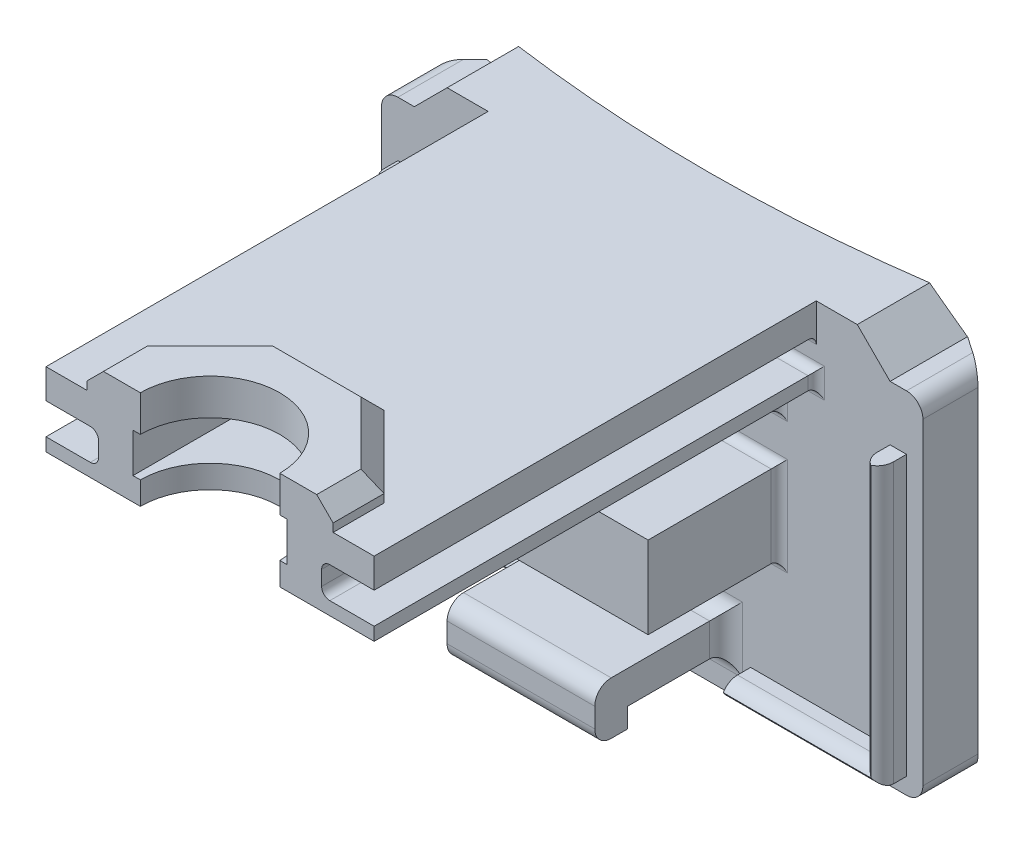
from build123d import *
from build123d.topology import SkipClean

# Parameters (mm, degrees)
BOSS_EXTRUDE1_DEPTH            = 3
SKETCH6_W                      = 20
SKETCH6_H                      = 31.95
BOSS_EXTRUDE5_DEPTH            = 5
CUT_EXTRUDE1_REACH             = 47.155
BOSS_EXTRUDE6_START            = 1.5
BOSS_EXTRUDE6_DEPTH            = 1.5
CHAMFER1_SIZE                  = 1
SKETCH10_W                     = 15.5
SKETCH10_H                     = 22.5
BOSS_EXTRUDE7_DEPTH            = 1.75
BOSS_EXTRUDE8_DEPTH            = 8
BOSS_EXTRUDE9_DEPTH            = 23.35
CHAMFER3_SIZE                  = 1.7121869
CHAMFER3_SIZE_2                = 2
FILLET4_R                      = 1
CHAMFER4_SIZE                  = 2
CUT_EXTRUDE2_DEPTH             = 42.166529183
CUT_EXTRUDE3_DEPTH             = 3.2
CUT_EXTRUDE4_DEPTH             = 3.2
SKETCH16_W                     = 9.2
SKETCH16_H                     = 4.6
CUT_EXTRUDE5_DEPTH             = 2.2
BOSS_EXTRUDE10_DEPTH           = 1.8
BOSS_EXTRUDE11_DEPTH           = 8
SKETCH19_W                     = 9
SKETCH19_H                     = 2
BOSS_EXTRUDE12_DEPTH           = 1.2
FILLET7_R                      = 1
FILLET8_R                      = 1
CUT_EXTRUDE6_DEPTH             = 0.5
CUT_EXTRUDE8_REACH             = 45.001
CUT_EXTRUDE8_DIRECTION_2_REACH = 45.001
BOSS_EXTRUDE13_DEPTH           = 7.6
BOSS_EXTRUDE14_DEPTH           = 1.5
CUT_EXTRUDE9_REACH             = 44.27
CHAMFER6_SIZE                  = 1
CUT_EXTRUDE14_START            = -2.25
CUT_EXTRUDE14_DEPTH            = 2.25
SKETCH30_W                     = 9.2
SKETCH30_H                     = 4.6
CUT_EXTRUDE15_DEPTH            = 3.7
SKETCH31_W                     = 9.2
SKETCH31_H                     = 4.6
BOSS_EXTRUDE16_DEPTH           = 1.5
SKETCH32_R                     = 4
CUT_EXTRUDE16_DEPTH            = 1.5
FILLET9_R                      = 0.5
FILLET10_R                     = 0.5
CUT_EXTRUDE18_DEPTH            = 35.725461753
CUT_EXTRUDE18_DEPTH_BACK       = 2.3
SKETCH34_W                     = 9.4
SKETCH34_H                     = 2.4
FILLET11_R                     = 1
SKETCH35_R                     = 4.25
CUT_EXTRUDE19_DEPTH            = 7


# Some blends are built 0.0001 mm under size
with BuildPart() as part:
    # Sketch1 → Boss-Extrude1 (new body)
    with BuildSketch(Plane.XY):
        Polygon((14.5, 12.675), (-14.5, 12.675), (-14.5, 10.675), (-16.5, 10.675), (-16.5, -10.675), (16.5, -10.675), (16.5, 10.675), (14.5, 10.675), align=None)
    extrude(amount=BOSS_EXTRUDE1_DEPTH)

    # Sketch6 → Boss-Extrude5 (add)
    with BuildSketch(Plane(origin=(0, 12.675, 0), x_dir=(1, 0, 0), z_dir=(0, 1, 0))):
        with Locations((0, -18.975)):
            Rectangle(SKETCH6_W, SKETCH6_H)
    extrude(amount=-BOSS_EXTRUDE5_DEPTH)

    # Sketch7 → Cut-Extrude1 (cut, up to next)
    with BuildSketch(Plane(origin=(0, 12.675, 0), x_dir=(1, 0, 0), z_dir=(0, 1, 0)), mode=Mode.PRIVATE) as cut_extrude1_sk1:
        with BuildLine():
            Line((-4, -34.95), (4, -34.95))
            ThreePointArc((4, -34.95), (0, -30.95), (-4, -34.95))
        make_face()
    cut_extrude1_tool1 = extrude(cut_extrude1_sk1.sketch, amount=-CUT_EXTRUDE1_REACH, mode=Mode.PRIVATE) & part.part
    add(cut_extrude1_tool1.solids().sort_by_distance((0, 12.675, 33.252347))[0], mode=Mode.SUBTRACT)

    # Sketch8 → Boss-Extrude6 (add)
    with BuildSketch(Plane(origin=(0, 12.675, 0), x_dir=(1, 0, 0), z_dir=(0, 1, 0)).offset(BOSS_EXTRUDE6_START)):
        with BuildLine():
            Line((-7.5, -34.95), (-4, -34.95))
            ThreePointArc((-4, -34.95), (0, -30.95), (4, -34.95))
            Line((4, -34.95), (7.5, -34.95))
            Line((7.5, -34.95), (7.5, -31.843398282))
            Line((7.5, -31.843398282), (3.106601718, -27.45))
            Line((3.106601718, -27.45), (-3.106601718, -27.45))
            Line((-3.106601718, -27.45), (-7.5, -31.843398282))
            Line((-7.5, -31.843398282), (-7.5, -34.95))
        make_face()
    extrude(amount=-BOSS_EXTRUDE6_DEPTH)

    # Chamfer1
    chamfer1_edges = [part.edges().sort_by_distance(p)[0] for p in [
        (-7.5, 14.175, 33.396699141),
        (7.5, 14.175, 33.396699141),
        (5.303300859, 14.175, 29.646699141),
        (0, 14.175, 27.45),
        (-5.303300859, 14.175, 29.646699141),
    ]]
    chamfer(chamfer1_edges, length=CHAMFER1_SIZE)

    # Sketch10 → Boss-Extrude7 (add)
    with BuildSketch(Plane.XZ.offset(-7.675)):
        with Locations((0, 14.25)):
            Rectangle(SKETCH10_W, SKETCH10_H)
    extrude(amount=BOSS_EXTRUDE7_DEPTH)

    # Sketch11 → Boss-Extrude8 (add)
    with BuildSketch(Plane.XY.offset(3)):
        Polygon((-7.75, 1.425), (-7.75, -2.075), (7.75, -2.075), (7.75, 1.425), (7.75, 2.925), (-7.75, 2.925), align=None)
    extrude(amount=BOSS_EXTRUDE8_DEPTH)

    # Sketch12 → Boss-Extrude9 (add, through all)
    with BuildSketch(Plane(origin=(0, 12.675, 0), x_dir=(1, 0, 0), z_dir=(0, 1, 0))):
        with BuildLine():
            Line((-16.5, 0), (-16.5, 2))
            ThreePointArc((-16.5, 2), (0.003271262, 0.509953036), (16.5, 2.070767971))
            Line((16.5, 2.070767971), (16.5, 0))
            Line((16.5, 0), (-16.5, 0))
        make_face()
    extrude(amount=-BOSS_EXTRUDE9_DEPTH)

    # Chamfer3
    # the kernel refuses this chamfer: 2, 1.717229303, 1.7121869 mm, written as the material it takes off along each edge
    with BuildSketch(Plane(origin=(16.5, 17.877033417, -2.070767971), x_dir=(0, 0, 1), z_dir=(0, -1, 0))) as chamfer3_piece_1:
        with BuildLine():
            Line((CHAMFER3_SIZE, 0), (0.352759752, 1.991865139))
            ThreePointArc((0.352759752, 1.991865139), (0.186961159, 1.023114885), (0, 0))
            Line((0, 0), (CHAMFER3_SIZE, 0))
        make_face()
    extrude(amount=33.754066833, mode=Mode.SUBTRACT)
    with BuildSketch(Plane(origin=(-16.5, 17.818365976, -2), x_dir=(0.9851367782716596, 0, 0.17177173253051592), z_dir=(0, -1, 0))) as chamfer3_piece_2:
        with BuildLine():
            Line((1.72874517, 0), (CHAMFER3_SIZE_2 * 0.171771732531, CHAMFER3_SIZE_2 * 0.985136778272))
            Line((CHAMFER3_SIZE_2 * 0.171771732531, CHAMFER3_SIZE_2 * 0.985136778272), (0, 0))
            ThreePointArc((0, 0), (0.887387451, 0.004147931), (1.72874517, 0))
        make_face()
    extrude(amount=33.636731952, mode=Mode.SUBTRACT)

    # Fillet4
    fillet4_edges = [part.edges().sort_by_distance(p)[0] for p in [
        (16.5, 10.675, 1.5),
        (16.5, -10.675, 1.320709464),
        (-16.5, -10.675, 1.5),
        (-16.5, 10.675, 1.5),
    ]]
    fillet(fillet4_edges, radius=FILLET4_R)

    # Chamfer4
    chamfer4_edges = [part.edges().sort_by_distance(p)[0] for p in [
        (-14.5, 12.675, 1.5),
        (14.5, 12.675, 1.5),
    ]]
    chamfer(chamfer4_edges, length=CHAMFER4_SIZE - 0.0001)  # a hair under: the kernel refuses the full size

    # Sketch13 → Cut-Extrude2 (cut, through all)
    with SkipClean():  # the faces are left unmerged after this step: merging them gives an invalid solid
        with BuildSketch(Plane.XY):
            with BuildLine():
                Line((12.5, 12.675), (16.5, 12.675))
                Line((16.5, 12.675), (16.5, 9.675))
                ThreePointArc((16.5, 9.675), (16.207106781, 10.382106781), (15.5, 10.675))
                Line((15.5, 10.675), (14.5, 10.675))
                Line((14.5, 10.675), (12.5, 12.675))
            make_face()
            with BuildLine():
                Line((-12.5, 12.675), (-16.5, 12.675))
                Line((-16.5, 12.675), (-16.5, 9.675))
                ThreePointArc((-16.5, 9.675), (-16.207106781, 10.382106781), (-15.5, 10.675))
                Line((-15.5, 10.675), (-14.5, 10.675))
                Line((-14.5, 10.675), (-12.5, 12.675))
            make_face()
        extrude(amount=-CUT_EXTRUDE2_DEPTH, mode=Mode.SUBTRACT)

    # Sketch14 → Cut-Extrude3 (cut)
    with SkipClean():  # the faces are left unmerged after this step: merging them gives an invalid solid
        with BuildSketch(Plane(origin=(10, 0, 0), x_dir=(0, 0, -1), z_dir=(1, 0, 0))):
            Polygon((-34.95, 10.875), (-34.95, 8.975), (-29.75, 8.975), (-3, 8.975), (-3, 10.875), (-29.75, 10.875), align=None)
        extrude(amount=-CUT_EXTRUDE3_DEPTH, mode=Mode.SUBTRACT)

    # Sketch15 → Cut-Extrude4 (cut)
    with SkipClean():  # the faces are left unmerged after this step: merging them gives an invalid solid
        with BuildSketch(Plane.ZY.offset(10)):
            Polygon((34.95, 10.875), (34.95, 8.975), (29.75, 8.975), (3, 8.975), (3, 10.875), (29.75, 10.875), align=None)
        extrude(amount=-CUT_EXTRUDE4_DEPTH, mode=Mode.SUBTRACT)

    # Sketch16 → Cut-Extrude5 (cut)
    with SkipClean():  # the faces are left unmerged after this step: merging them gives an invalid solid
        with BuildSketch(Plane.XZ.offset(-7.675)):
            with Locations((0, 32.65)):
                Rectangle(SKETCH16_W, SKETCH16_H)
        extrude(amount=-CUT_EXTRUDE5_DEPTH, mode=Mode.SUBTRACT)

    # Sketch17 → Boss-Extrude10 (add)
    with SkipClean():  # the faces are left unmerged after this step: merging them gives an invalid solid
        with BuildSketch(Plane.XY.offset(3)):
            Polygon((-15.5, -9.675), (-6, -9.675), (-6, -8.675), (-14.5, -8.675), (-14.5, 7.325), (-15.5, 7.325), align=None)
            Polygon((15.5, -9.675), (15.5, 7.325), (14.5, 7.325), (14.5, -8.675), (6, -8.675), (6, -9.675), align=None)
        extrude(amount=BOSS_EXTRUDE10_DEPTH)

    # Sketch18 → Boss-Extrude11 (add)
    with SkipClean():  # the faces are left unmerged after this step: merging them gives an invalid solid
        with BuildSketch(Plane.XY.offset(3)):
            Polygon((0, -8.475), (4.5, -8.475), (4.5, -6.475), (0, -6.475), (-4.5, -6.475), (-4.5, -8.475), align=None)
        extrude(amount=BOSS_EXTRUDE11_DEPTH)

    # Sketch19 → Boss-Extrude12 (add)
    with SkipClean():  # the faces are left unmerged after this step: merging them gives an invalid solid
        with BuildSketch(Plane.XZ.offset(8.475)):
            with Locations((0, 10)):
                Rectangle(SKETCH19_W, SKETCH19_H)
        extrude(amount=BOSS_EXTRUDE12_DEPTH)

    # Fillet7
    # the kernel refuses this fillet: 1 mm, written as the material it takes off along each edge
    with BuildSketch(Plane(origin=(-3.5, -8.675, 4.8), x_dir=(0, 0, -1), z_dir=(-1, 0, 0)), Plane(origin=(14.5, -8.675, 4.8), x_dir=(0, 0, -1), z_dir=(-1, 0, 0))) as fillet7_piece_1:
        with BuildLine():
            CenterArc((FILLET7_R, FILLET7_R), FILLET7_R, 180, 90)
            Line((0, FILLET7_R), (0, 0))
            Line((0, 0), (FILLET7_R, 0))
        make_face()
    extrude(amount=11, mode=Mode.SUBTRACT)
    with BuildSketch(Plane(origin=(14.5, 9.825, 4.8), x_dir=(0, 0, -1), z_dir=(0, -1, 0)), Plane(origin=(-14.5, -8.675, 4.8), x_dir=(0, 0, -1), z_dir=(0, 1, 0))) as fillet7_piece_2:
        with BuildLine():
            CenterArc((FILLET7_R, FILLET7_R), FILLET7_R, 180, 90)
            Line((0, FILLET7_R), (0, 0))
            Line((0, 0), (FILLET7_R, 0))
        make_face()
    extrude(amount=18.5, mode=Mode.SUBTRACT)
    with BuildSketch(Plane(origin=(15.5, -12.175, 4.8), x_dir=(0, 0, -1), z_dir=(0, 1, 0)), Plane(origin=(-15.5, 9.825, 4.8), x_dir=(0, 0, -1), z_dir=(0, -1, 0))) as fillet7_piece_3:
        with BuildLine():
            CenterArc((FILLET7_R, FILLET7_R), FILLET7_R, 180, 90)
            Line((0, FILLET7_R), (0, 0))
            Line((0, 0), (FILLET7_R, 0))
        make_face()
    extrude(amount=22, mode=Mode.SUBTRACT)
    with BuildSketch(Plane(origin=(-18, -9.675, 4.8), x_dir=(0, 0, -1), z_dir=(1, 0, 0)), Plane(origin=(3.5, -9.675, 4.8), x_dir=(0, 0, -1), z_dir=(1, 0, 0))) as fillet7_piece_4:
        with BuildLine():
            CenterArc((FILLET7_R, FILLET7_R), FILLET7_R, 180, 90)
            Line((0, FILLET7_R), (0, 0))
            Line((0, 0), (FILLET7_R, 0))
        make_face()
    extrude(amount=14.5, mode=Mode.SUBTRACT)
    with BuildSketch(Plane(origin=(-6, -8.675, 4.8), x_dir=(0, 0, -1), z_dir=(-1, 0, 0))) as fillet7_piece_5a_section:
        with BuildLine():
            CenterArc((FILLET7_R, FILLET7_R), FILLET7_R, 180, 90)
            Line((0, FILLET7_R), (0, 0))
            Line((0, 0), (FILLET7_R, 0))
        make_face()
    fillet7_piece_5a = extrude(amount=11, mode=Mode.PRIVATE)
    fillet7_piece_5a = split(fillet7_piece_5a, bisect_by=Plane(origin=(-15.5, -8.675, 4.8), z_dir=(1, 0, 0)), keep=Keep.TOP, mode=Mode.PRIVATE)
    fillet7_piece_5a = split(fillet7_piece_5a, bisect_by=Plane(origin=(-14.5, -8.675, 4.8), z_dir=(-1, 0, 0)), keep=Keep.TOP, mode=Mode.PRIVATE)
    with BuildSketch(Plane(origin=(-14.5, -11.175, 4.8), x_dir=(0, 0, -1), z_dir=(0, 1, 0))) as fillet7_piece_5b_section:
        with BuildLine():
            CenterArc((FILLET7_R, FILLET7_R), FILLET7_R, 180, 90)
            Line((0, FILLET7_R), (0, 0))
            Line((0, 0), (FILLET7_R, 0))
        make_face()
    fillet7_piece_5b = extrude(amount=18.5, mode=Mode.PRIVATE)
    fillet7_piece_5b = split(fillet7_piece_5b, bisect_by=Plane(origin=(-14.5, -9.675, 4.8), z_dir=(0, 1, 0)), keep=Keep.TOP, mode=Mode.PRIVATE)
    fillet7_piece_5b = split(fillet7_piece_5b, bisect_by=Plane(origin=(-14.5, -8.675, 4.8), z_dir=(0, -1, 0)), keep=Keep.TOP, mode=Mode.PRIVATE)
    fillet7_piece_5 = fillet7_piece_5a & fillet7_piece_5b
    add(fillet7_piece_5, mode=Mode.SUBTRACT)
    with BuildSketch(Plane(origin=(14.5, 7.325, 4.8), x_dir=(0, 0, -1), z_dir=(0, -1, 0))) as fillet7_piece_6a_section:
        with BuildLine():
            CenterArc((FILLET7_R, FILLET7_R), FILLET7_R, 180, 90)
            Line((0, FILLET7_R), (0, 0))
            Line((0, 0), (FILLET7_R, 0))
        make_face()
    fillet7_piece_6a = extrude(amount=18.5, mode=Mode.PRIVATE)
    fillet7_piece_6a = split(fillet7_piece_6a, bisect_by=Plane(origin=(14.5, -9.675, 4.8), z_dir=(0, 1, 0)), keep=Keep.TOP, mode=Mode.PRIVATE)
    fillet7_piece_6a = split(fillet7_piece_6a, bisect_by=Plane(origin=(14.5, -8.675, 4.8), z_dir=(0, -1, 0)), keep=Keep.TOP, mode=Mode.PRIVATE)
    with BuildSketch(Plane(origin=(17, -8.675, 4.8), x_dir=(0, 0, -1), z_dir=(-1, 0, 0))) as fillet7_piece_6b_section:
        with BuildLine():
            CenterArc((FILLET7_R, FILLET7_R), FILLET7_R, 180, 90)
            Line((0, FILLET7_R), (0, 0))
            Line((0, 0), (FILLET7_R, 0))
        make_face()
    fillet7_piece_6b = extrude(amount=11, mode=Mode.PRIVATE)
    fillet7_piece_6b = split(fillet7_piece_6b, bisect_by=Plane(origin=(15.5, -8.675, 4.8), z_dir=(-1, 0, 0)), keep=Keep.TOP, mode=Mode.PRIVATE)
    fillet7_piece_6b = split(fillet7_piece_6b, bisect_by=Plane(origin=(14.5, -8.675, 4.8), z_dir=(1, 0, 0)), keep=Keep.TOP, mode=Mode.PRIVATE)
    fillet7_piece_6 = fillet7_piece_6a & fillet7_piece_6b
    add(fillet7_piece_6, mode=Mode.SUBTRACT)

    # Fillet8
    fillet8_edges = [part.edges().sort_by_distance(p)[0] for p in [
        (0, -8.475, 3),
        (4.5, -7.475, 3),
        (0, -6.475, 3),
        (-4.5, -7.475, 3),
    ]]
    fillet(fillet8_edges, radius=FILLET8_R)

    # Sketch21 → Cut-Extrude6 (cut)
    with SkipClean():  # the faces are left unmerged after this step: merging them gives an invalid solid
        with BuildSketch(Plane.XZ.offset(-7.675)):
            Polygon((-4.6, 30.35), (-4.6, 34.95), (-10, 34.95), (-10, 30.35), (-10, 3), (-7.75, 3), (-7.75, 25.5), (7.75, 25.5), (7.75, 3), (10, 3), (10, 30.35), (10, 34.95), (4.6, 34.95), (4.6, 30.35), align=None)
        extrude(amount=-CUT_EXTRUDE6_DEPTH, mode=Mode.SUBTRACT)

    # Sketch22 → Cut-Extrude8 (cut, up to next)
    with BuildSketch(Plane.XZ.offset(-8.175), mode=Mode.PRIVATE) as cut_extrude8_sk1:
        Polygon((-10, 27.35), (-10, 34.95), (10, 34.95), (10, 27.35), (10, 22.35), (0, 22.35), (-10, 22.35), align=None)
    cut_extrude8_tool1 = extrude(cut_extrude8_sk1.sketch, amount=-CUT_EXTRUDE8_REACH, mode=Mode.PRIVATE) & part.part
    add(cut_extrude8_tool1.solids().sort_by_distance((0, 8.175, 28.65))[0], mode=Mode.SUBTRACT)

    # Sketch22 → Cut-Extrude8 direction 2 (cut, up to next)
    with BuildSketch(Plane.XZ.offset(-8.175), mode=Mode.PRIVATE) as cut_extrude8_direction_2_sk1:
        Polygon((-10, 27.35), (-10, 34.95), (10, 34.95), (10, 27.35), (10, 22.35), (0, 22.35), (-10, 22.35), align=None)
    cut_extrude8_direction_2_tool1 = extrude(cut_extrude8_direction_2_sk1.sketch, amount=CUT_EXTRUDE8_DIRECTION_2_REACH, mode=Mode.PRIVATE) & part.part
    add(cut_extrude8_direction_2_tool1.solids().sort_by_distance((0, 8.175, 28.65))[0], mode=Mode.SUBTRACT)

    # Sketch23 → Boss-Extrude13 (add)
    with SkipClean():  # the faces are left unmerged after this step: merging them gives an invalid solid
        with BuildSketch(Plane.XY.offset(22.35)):
            Polygon((-10, 12.675), (10, 12.675), (10, 10.875), (6.8, 10.875), (6.8, 8.975), (10, 8.975), (10, 8.175), (7.75, 8.175), (7.75, 5.925), (-7.75, 5.925), (-7.75, 8.175), (-10, 8.175), (-10, 8.975), (-6.8, 8.975), (-6.8, 10.875), (-10, 10.875), align=None)
        extrude(amount=BOSS_EXTRUDE13_DEPTH)

    # Sketch24 → Boss-Extrude14 (add)
    with SkipClean():  # the faces are left unmerged after this step: merging them gives an invalid solid
        with BuildSketch(Plane(origin=(0, 12.675, 0), x_dir=(1, 0, 0), z_dir=(0, 1, 0))):
            Polygon((7.5, -26.843398282), (3.106601718, -22.45), (-3.106601718, -22.45), (-7.5, -26.843398282), (-7.5, -29.95), (7.5, -29.95), align=None)
        extrude(amount=BOSS_EXTRUDE14_DEPTH)

    # Sketch25 → Cut-Extrude9 (cut, up to next)
    with BuildSketch(Plane(origin=(0, 14.175, 0), x_dir=(1, 0, 0), z_dir=(0, 1, 0)), mode=Mode.PRIVATE) as cut_extrude9_sk1:
        with BuildLine():
            Line((-4, -29.95), (4, -29.95))
            ThreePointArc((4, -29.95), (0, -25.95), (-4, -29.95))
        make_face()
    cut_extrude9_tool1 = extrude(cut_extrude9_sk1.sketch, amount=-CUT_EXTRUDE9_REACH, mode=Mode.PRIVATE) & part.part
    add(cut_extrude9_tool1.solids().sort_by_distance((0, 14.175, 28.252347))[0], mode=Mode.SUBTRACT)

    # Chamfer6
    chamfer6_edges = [part.edges().sort_by_distance(p)[0] for p in [
        (7.5, 14.175, 28.396699141),
        (5.303300859, 14.175, 24.646699141),
        (0, 14.175, 22.45),
        (-5.303300859, 14.175, 24.646699141),
        (-7.5, 14.175, 28.396699141),
    ]]
    chamfer(chamfer6_edges, length=CHAMFER6_SIZE)

    # Sketch29 → Cut-Extrude14 (cut)
    with SkipClean():  # the faces are left unmerged after this step: merging them gives an invalid solid
        with BuildSketch(Plane.XZ.offset(-5.925).offset(CUT_EXTRUDE14_START)):
            with BuildLine():
                Line((-7.75, 29.95), (-4, 29.95))
                ThreePointArc((-4, 29.95), (0, 25.95), (4, 29.95))
                Line((4, 29.95), (7.75, 29.95))
                Line((7.75, 29.95), (7.75, 19.45))
                Line((7.75, 19.45), (-7.75, 19.45))
                Line((-7.75, 19.45), (-7.75, 29.95))
            make_face()
        extrude(amount=CUT_EXTRUDE14_DEPTH, mode=Mode.SUBTRACT)

    # Sketch30 → Cut-Extrude15 (cut)
    with SkipClean():  # the faces are left unmerged after this step: merging them gives an invalid solid
        with BuildSketch(Plane.XZ.offset(-8.175)):
            with Locations((0, 27.65)):
                Rectangle(SKETCH30_W, SKETCH30_H)
        extrude(amount=-CUT_EXTRUDE15_DEPTH, mode=Mode.SUBTRACT)

    # Sketch31 → Boss-Extrude16 (add)
    with SkipClean():  # the faces are left unmerged after this step: merging them gives an invalid solid
        with BuildSketch(Plane.XZ.offset(-8.175)):
            with Locations((0, 27.65)):
                Rectangle(SKETCH31_W, SKETCH31_H)
        extrude(amount=-BOSS_EXTRUDE16_DEPTH)

    # Sketch32 → Cut-Extrude16 (cut)
    with SkipClean():  # the faces are left unmerged after this step: merging them gives an invalid solid
        with BuildSketch(Plane(origin=(0, 9.675, 0), x_dir=(1, 0, 0), z_dir=(0, 1, 0))):
            with Locations((0, -29.95)):
                Circle(SKETCH32_R)
        extrude(amount=-CUT_EXTRUDE16_DEPTH, mode=Mode.SUBTRACT)

    # Fillet9
    fillet9_edges = [part.edges().sort_by_distance(p)[0] for p in [
        (6.8, 10.875, 12.675),
        (-6.8, 8.975, 12.675),
        (-6.8, 10.875, 12.675),
        (6.8, 8.975, 12.675),
    ]]
    fillet(fillet9_edges, radius=FILLET9_R)

    # Fillet10
    # the kernel refuses this fillet: 0.5 mm, written as the material it adds along each edge
    with BuildSketch(Plane(origin=(10, 8.975, 3), x_dir=(0, 0, 1), z_dir=(-1, 0, 0)), Plane(origin=(-10, 8.975, 3), x_dir=(0, 1, 0), z_dir=(1, 0, 0))) as fillet10_piece_1:
        with BuildLine():
            CenterArc((FILLET10_R, FILLET10_R), FILLET10_R, 180, 90)
            Line((0, FILLET10_R), (0, 0))
            Line((0, 0), (FILLET10_R, 0))
        make_face()
    extrude(amount=2.7)
    with BuildSketch(Plane(origin=(7.3, 9.475, 3), x_dir=(0, -1, 0), z_dir=(1, 0, 0))) as fillet10_piece_2:
        with BuildLine():
            CenterArc((0.5 - FILLET10_R, -FILLET10_R), FILLET10_R, 0, 90)
            Line((0.5 - FILLET10_R, 0), (0.5, 0))
            Line((0.5, 0), (0.5, -FILLET10_R))
        make_face()
    revolve(axis=Axis((7.3, 9.475, 3), (0, 0, -1)), revolution_arc=90)
    with BuildSketch(Plane(origin=(10, 8.975, 3), x_dir=(0, 0, 1), z_dir=(0, -1, 0)), Plane(origin=(-10, 8.975, 3), x_dir=(-1, 0, 0), z_dir=(0, -1, 0))) as fillet10_piece_3:
        with BuildLine():
            CenterArc((FILLET10_R, -FILLET10_R), FILLET10_R, 90, 90)
            Line((0, -FILLET10_R), (0, 0))
            Line((0, 0), (FILLET10_R, 0))
        make_face()
    extrude(amount=0.8)
    with BuildSketch(Plane(origin=(6.8, 9.475, 3), x_dir=(0, 0, 1), z_dir=(0, 1, 0)), Plane(origin=(-6.8, 9.475, 3), x_dir=(-1, 0, 0), z_dir=(0, 1, 0))) as fillet10_piece_4:
        with BuildLine():
            CenterArc((FILLET10_R, FILLET10_R), FILLET10_R, 180, 90)
            Line((0, FILLET10_R), (0, 0))
            Line((0, 0), (FILLET10_R, 0))
        make_face()
    extrude(amount=0.9)
    with BuildSketch(Plane(origin=(6.5, 8.175, 3), x_dir=(0, 0, 1), z_dir=(1, 0, 0)), Plane(origin=(-10, 8.175, 3), x_dir=(0, 0, 1), z_dir=(1, 0, 0))) as fillet10_piece_5:
        with BuildLine():
            CenterArc((FILLET10_R, FILLET10_R), FILLET10_R, 180, 90)
            Line((0, FILLET10_R), (0, 0))
            Line((0, 0), (FILLET10_R, 0))
        make_face()
    extrude(amount=3.5)
    with BuildSketch(Plane(origin=(7.3, 10.375, 3), x_dir=(-1, 0, 0), z_dir=(0, -1, 0))) as fillet10_piece_6:
        with BuildLine():
            CenterArc((0.5 - FILLET10_R, -FILLET10_R), FILLET10_R, 0, 90)
            Line((0.5 - FILLET10_R, 0), (0.5, 0))
            Line((0.5, 0), (0.5, -FILLET10_R))
        make_face()
    revolve(axis=Axis((7.3, 10.375, 3), (0, 0, -1)), revolution_arc=90)
    with BuildSketch(Plane(origin=(10, 10.875, 3), x_dir=(0, 0, 1), z_dir=(-1, 0, 0)), Plane(origin=(-10, 10.875, 3), x_dir=(0, -1, 0), z_dir=(1, 0, 0))) as fillet10_piece_7:
        with BuildLine():
            CenterArc((FILLET10_R, -FILLET10_R), FILLET10_R, 90, 90)
            Line((0, -FILLET10_R), (0, 0))
            Line((0, 0), (FILLET10_R, 0))
        make_face()
    extrude(amount=2.7)
    with BuildSketch(Plane(origin=(7.75, 7.675, 3), x_dir=(1, 0, 0), z_dir=(0, -1, 0))) as fillet10_piece_8:
        with BuildLine():
            CenterArc((FILLET10_R, FILLET10_R), FILLET10_R, 180, 90)
            Line((0, FILLET10_R), (0, 0))
            Line((0, 0), (FILLET10_R, 0))
        make_face()
    extrude(amount=1.75)
    with BuildSketch(Plane(origin=(-7.75, 5.925, 3), x_dir=(0, -1, 0), z_dir=(1, 0, 0)), Plane(origin=(7.75, 2.925, 3), x_dir=(0, 1, 0), z_dir=(-1, 0, 0)), Plane(origin=(-7.75, -2.075, 3), x_dir=(0, -1, 0), z_dir=(1, 0, 0))) as fillet10_piece_9:
        with BuildLine():
            CenterArc((FILLET10_R, -FILLET10_R), FILLET10_R, 90, 90)
            Line((0, -FILLET10_R), (0, 0))
            Line((0, 0), (FILLET10_R, 0))
        make_face()
    extrude(amount=15.5)
    with BuildSketch(Plane(origin=(-7.75, 7.675, 3), x_dir=(-1, 0, 0), z_dir=(0, -1, 0))) as fillet10_piece_10:
        with BuildLine():
            CenterArc((FILLET10_R, -FILLET10_R), FILLET10_R, 90, 90)
            Line((0, -FILLET10_R), (0, 0))
            Line((0, 0), (FILLET10_R, 0))
        make_face()
    extrude(amount=1.75)
    with BuildSketch(Plane(origin=(-7.75, 2.925, 3), x_dir=(-1, 0, 0), z_dir=(0, -1, 0)), Plane(origin=(7.75, -2.075, 3), x_dir=(1, 0, 0), z_dir=(0, 1, 0))) as fillet10_piece_11:
        with BuildLine():
            CenterArc((FILLET10_R, -FILLET10_R), FILLET10_R, 90, 90)
            Line((0, -FILLET10_R), (0, 0))
            Line((0, 0), (FILLET10_R, 0))
        make_face()
    extrude(amount=5)
    with BuildSketch(Plane(origin=(7.75, 7.675, 3), x_dir=(1, 0, 0), z_dir=(0, 1, 0))) as fillet10_piece_12:
        with BuildLine():
            CenterArc((FILLET10_R, -FILLET10_R), FILLET10_R, 90, 90)
            Line((0, -FILLET10_R), (0, 0))
            Line((0, 0), (FILLET10_R, 0))
        make_face()
    extrude(amount=0.5)
    with BuildSketch(Plane(origin=(-7.75, 7.675, 3), x_dir=(0, 0, 1), z_dir=(0, 1, 0))) as fillet10_piece_13_section:
        with BuildLine():
            CenterArc((FILLET10_R, -FILLET10_R), FILLET10_R, 90, 90)
            Line((0, -FILLET10_R), (0, 0))
            Line((0, 0), (FILLET10_R, 0))
        make_face()
    fillet10_piece_13 = extrude(amount=1.75, mode=Mode.PRIVATE)
    fillet10_piece_13 = split(fillet10_piece_13, bisect_by=Plane(origin=(-7.75, 8.975, 3), z_dir=(0, -1, 0)), keep=Keep.TOP, mode=Mode.PRIVATE)
    add(fillet10_piece_13)
    with BuildSketch(Plane(origin=(-7.3, 9.475, 3), x_dir=(1, 0, 0), z_dir=(0, 1, 0))) as fillet10_piece_14:
        with BuildLine():
            CenterArc((0.5 - FILLET10_R, -FILLET10_R), FILLET10_R, 0, 90)
            Line((0.5, -FILLET10_R), (0.5, 0))
            Line((0.5, 0), (0.5 - FILLET10_R, 0))
        make_face()
    revolve(axis=Axis((-7.3, 9.475, 3), (0, 0, -1)), revolution_arc=90)
    with BuildSketch(Plane(origin=(-7.3, 10.375, 3), x_dir=(0, 1, 0), z_dir=(-1, 0, 0))) as fillet10_piece_15:
        with BuildLine():
            CenterArc((0.5 - FILLET10_R, -FILLET10_R), FILLET10_R, 360, 90)
            Line((0.5, -FILLET10_R), (0.5, 0))
            Line((0.5, 0), (0.5 - FILLET10_R, 0))
        make_face()
    revolve(axis=Axis((-7.3, 10.375, 3), (0, 0, -1)), revolution_arc=90)
    with BuildSketch(Plane(origin=(11.25, 8.975, 3), x_dir=(0, 0, 1), z_dir=(-1, 0, 0))) as fillet10_piece_16a_section:
        with BuildLine():
            CenterArc((FILLET10_R, FILLET10_R), FILLET10_R, 180, 90)
            Line((0, FILLET10_R), (0, 0))
            Line((0, 0), (FILLET10_R, 0))
        make_face()
    fillet10_piece_16a = extrude(amount=3.95, mode=Mode.PRIVATE)
    fillet10_piece_16a = split(fillet10_piece_16a, bisect_by=Plane(origin=(10, 8.975, 3), z_dir=(1, 0, 0)), keep=Keep.TOP, mode=Mode.PRIVATE)
    with BuildSketch(Plane(origin=(10, 10.225, 3), x_dir=(0, 0, 1), z_dir=(0, -1, 0))) as fillet10_piece_16b_section:
        with BuildLine():
            CenterArc((FILLET10_R, -FILLET10_R), FILLET10_R, 90, 90)
            Line((0, -FILLET10_R), (0, 0))
            Line((0, 0), (FILLET10_R, 0))
        make_face()
    fillet10_piece_16b = extrude(amount=2.05, mode=Mode.PRIVATE)
    fillet10_piece_16b = split(fillet10_piece_16b, bisect_by=Plane(origin=(10, 8.975, 3), z_dir=(0, 1, 0)), keep=Keep.TOP, mode=Mode.PRIVATE)
    fillet10_piece_16 = fillet10_piece_16a & fillet10_piece_16b
    add(fillet10_piece_16)
    with BuildSketch(Plane(origin=(10, 8.975, 3), x_dir=(0, 0, 1), z_dir=(0, -1, 0))) as fillet10_piece_17a_section:
        with BuildLine():
            CenterArc((FILLET10_R, -FILLET10_R), FILLET10_R, 90, 90)
            Line((0, -FILLET10_R), (0, 0))
            Line((0, 0), (FILLET10_R, 0))
        make_face()
    fillet10_piece_17a = extrude(amount=2.05, mode=Mode.PRIVATE)
    fillet10_piece_17a = split(fillet10_piece_17a, bisect_by=Plane(origin=(10, 8.175, 3), z_dir=(0, -1, 0)), keep=Keep.TOP, mode=Mode.PRIVATE)
    with BuildSketch(Plane(origin=(7.75, 8.175, 3), x_dir=(0, 0, 1), z_dir=(1, 0, 0))) as fillet10_piece_17b_section:
        with BuildLine():
            CenterArc((FILLET10_R, FILLET10_R), FILLET10_R, 180, 90)
            Line((0, FILLET10_R), (0, 0))
            Line((0, 0), (FILLET10_R, 0))
        make_face()
    fillet10_piece_17b = extrude(amount=3.5, mode=Mode.PRIVATE)
    fillet10_piece_17b = split(fillet10_piece_17b, bisect_by=Plane(origin=(10, 8.175, 3), z_dir=(1, 0, 0)), keep=Keep.TOP, mode=Mode.PRIVATE)
    fillet10_piece_17 = fillet10_piece_17a & fillet10_piece_17b
    add(fillet10_piece_17)
    with BuildSketch(Plane(origin=(-11.25, 8.175, 3), x_dir=(0, 0, 1), z_dir=(1, 0, 0))) as fillet10_piece_18a_section:
        with BuildLine():
            CenterArc((FILLET10_R, FILLET10_R), FILLET10_R, 180, 90)
            Line((0, FILLET10_R), (0, 0))
            Line((0, 0), (FILLET10_R, 0))
        make_face()
    fillet10_piece_18a = extrude(amount=3.5, mode=Mode.PRIVATE)
    fillet10_piece_18a = split(fillet10_piece_18a, bisect_by=Plane(origin=(-10, 8.175, 3), z_dir=(-1, 0, 0)), keep=Keep.TOP, mode=Mode.PRIVATE)
    with BuildSketch(Plane(origin=(-10, 8.975, 3), x_dir=(-1, 0, 0), z_dir=(0, -1, 0))) as fillet10_piece_18b_section:
        with BuildLine():
            CenterArc((FILLET10_R, -FILLET10_R), FILLET10_R, 90, 90)
            Line((0, -FILLET10_R), (0, 0))
            Line((0, 0), (FILLET10_R, 0))
        make_face()
    fillet10_piece_18b = extrude(amount=2.05, mode=Mode.PRIVATE)
    fillet10_piece_18b = split(fillet10_piece_18b, bisect_by=Plane(origin=(-10, 8.175, 3), z_dir=(0, -1, 0)), keep=Keep.TOP, mode=Mode.PRIVATE)
    fillet10_piece_18 = fillet10_piece_18a & fillet10_piece_18b
    add(fillet10_piece_18)
    with BuildSketch(Plane(origin=(7.75, 7.675, 3), x_dir=(1, 0, 0), z_dir=(0, -1, 0))) as fillet10_piece_19a_section:
        with BuildLine():
            CenterArc((FILLET10_R, FILLET10_R), FILLET10_R, 180, 90)
            Line((0, FILLET10_R), (0, 0))
            Line((0, 0), (FILLET10_R, 0))
        make_face()
    fillet10_piece_19a = extrude(amount=3, mode=Mode.PRIVATE)
    fillet10_piece_19a = split(fillet10_piece_19a, bisect_by=Plane(origin=(7.75, 5.925, 3), z_dir=(0, -1, 0)), keep=Keep.TOP, mode=Mode.PRIVATE)
    with BuildSketch(Plane(origin=(-7.75, 5.925, 3), x_dir=(0, -1, 0), z_dir=(1, 0, 0))) as fillet10_piece_19b_section:
        with BuildLine():
            CenterArc((FILLET10_R, -FILLET10_R), FILLET10_R, 90, 90)
            Line((0, -FILLET10_R), (0, 0))
            Line((0, 0), (FILLET10_R, 0))
        make_face()
    fillet10_piece_19b = extrude(amount=16.75, mode=Mode.PRIVATE)
    fillet10_piece_19b = split(fillet10_piece_19b, bisect_by=Plane(origin=(7.75, 5.925, 3), z_dir=(1, 0, 0)), keep=Keep.TOP, mode=Mode.PRIVATE)
    fillet10_piece_19 = fillet10_piece_19a & fillet10_piece_19b
    add(fillet10_piece_19)
    with BuildSketch(Plane(origin=(-9, 5.925, 3), x_dir=(0, -1, 0), z_dir=(1, 0, 0))) as fillet10_piece_20a_section:
        with BuildLine():
            CenterArc((FILLET10_R, -FILLET10_R), FILLET10_R, 90, 90)
            Line((0, -FILLET10_R), (0, 0))
            Line((0, 0), (FILLET10_R, 0))
        make_face()
    fillet10_piece_20a = extrude(amount=16.75, mode=Mode.PRIVATE)
    fillet10_piece_20a = split(fillet10_piece_20a, bisect_by=Plane(origin=(-7.75, 5.925, 3), z_dir=(-1, 0, 0)), keep=Keep.TOP, mode=Mode.PRIVATE)
    with BuildSketch(Plane(origin=(-7.75, 7.675, 3), x_dir=(-1, 0, 0), z_dir=(0, -1, 0))) as fillet10_piece_20b_section:
        with BuildLine():
            CenterArc((FILLET10_R, -FILLET10_R), FILLET10_R, 90, 90)
            Line((0, -FILLET10_R), (0, 0))
            Line((0, 0), (FILLET10_R, 0))
        make_face()
    fillet10_piece_20b = extrude(amount=3, mode=Mode.PRIVATE)
    fillet10_piece_20b = split(fillet10_piece_20b, bisect_by=Plane(origin=(-7.75, 5.925, 3), z_dir=(0, -1, 0)), keep=Keep.TOP, mode=Mode.PRIVATE)
    fillet10_piece_20 = fillet10_piece_20a & fillet10_piece_20b
    add(fillet10_piece_20)
    with BuildSketch(Plane(origin=(-10, 10.225, 3), x_dir=(-1, 0, 0), z_dir=(0, -1, 0))) as fillet10_piece_21a_section:
        with BuildLine():
            CenterArc((FILLET10_R, -FILLET10_R), FILLET10_R, 90, 90)
            Line((0, -FILLET10_R), (0, 0))
            Line((0, 0), (FILLET10_R, 0))
        make_face()
    fillet10_piece_21a = extrude(amount=2.05, mode=Mode.PRIVATE)
    fillet10_piece_21a = split(fillet10_piece_21a, bisect_by=Plane(origin=(-10, 8.975, 3), z_dir=(0, 1, 0)), keep=Keep.TOP, mode=Mode.PRIVATE)
    with BuildSketch(Plane(origin=(-11.25, 8.975, 3), x_dir=(0, 1, 0), z_dir=(1, 0, 0))) as fillet10_piece_21b_section:
        with BuildLine():
            CenterArc((FILLET10_R, FILLET10_R), FILLET10_R, 180, 90)
            Line((0, FILLET10_R), (0, 0))
            Line((0, 0), (FILLET10_R, 0))
        make_face()
    fillet10_piece_21b = extrude(amount=3.95, mode=Mode.PRIVATE)
    fillet10_piece_21b = split(fillet10_piece_21b, bisect_by=Plane(origin=(-10, 8.975, 3), z_dir=(-1, 0, 0)), keep=Keep.TOP, mode=Mode.PRIVATE)
    fillet10_piece_21 = fillet10_piece_21a & fillet10_piece_21b
    add(fillet10_piece_21)
    with BuildSketch(Plane(origin=(-7.75, 4.175, 3), x_dir=(-1, 0, 0), z_dir=(0, -1, 0))) as fillet10_piece_22a_section:
        with BuildLine():
            CenterArc((FILLET10_R, -FILLET10_R), FILLET10_R, 90, 90)
            Line((0, -FILLET10_R), (0, 0))
            Line((0, 0), (FILLET10_R, 0))
        make_face()
    fillet10_piece_22a = extrude(amount=6.25, mode=Mode.PRIVATE)
    fillet10_piece_22a = split(fillet10_piece_22a, bisect_by=Plane(origin=(-7.75, 2.925, 3), z_dir=(0, 1, 0)), keep=Keep.TOP, mode=Mode.PRIVATE)
    with BuildSketch(Plane(origin=(7.75, 2.925, 3), x_dir=(0, 1, 0), z_dir=(-1, 0, 0))) as fillet10_piece_22b_section:
        with BuildLine():
            CenterArc((FILLET10_R, -FILLET10_R), FILLET10_R, 90, 90)
            Line((0, -FILLET10_R), (0, 0))
            Line((0, 0), (FILLET10_R, 0))
        make_face()
    fillet10_piece_22b = extrude(amount=16.75, mode=Mode.PRIVATE)
    fillet10_piece_22b = split(fillet10_piece_22b, bisect_by=Plane(origin=(-7.75, 2.925, 3), z_dir=(-1, 0, 0)), keep=Keep.TOP, mode=Mode.PRIVATE)
    fillet10_piece_22 = fillet10_piece_22a & fillet10_piece_22b
    add(fillet10_piece_22)
    with BuildSketch(Plane(origin=(-7.75, 2.925, 3), x_dir=(-1, 0, 0), z_dir=(0, -1, 0))) as fillet10_piece_23a_section:
        with BuildLine():
            CenterArc((FILLET10_R, -FILLET10_R), FILLET10_R, 90, 90)
            Line((0, -FILLET10_R), (0, 0))
            Line((0, 0), (FILLET10_R, 0))
        make_face()
    fillet10_piece_23a = extrude(amount=6.25, mode=Mode.PRIVATE)
    fillet10_piece_23a = split(fillet10_piece_23a, bisect_by=Plane(origin=(-7.75, -2.075, 3), z_dir=(0, -1, 0)), keep=Keep.TOP, mode=Mode.PRIVATE)
    with BuildSketch(Plane(origin=(-9, -2.075, 3), x_dir=(0, -1, 0), z_dir=(1, 0, 0))) as fillet10_piece_23b_section:
        with BuildLine():
            CenterArc((FILLET10_R, -FILLET10_R), FILLET10_R, 90, 90)
            Line((0, -FILLET10_R), (0, 0))
            Line((0, 0), (FILLET10_R, 0))
        make_face()
    fillet10_piece_23b = extrude(amount=16.75, mode=Mode.PRIVATE)
    fillet10_piece_23b = split(fillet10_piece_23b, bisect_by=Plane(origin=(-7.75, -2.075, 3), z_dir=(-1, 0, 0)), keep=Keep.TOP, mode=Mode.PRIVATE)
    fillet10_piece_23 = fillet10_piece_23a & fillet10_piece_23b
    add(fillet10_piece_23)
    with BuildSketch(Plane(origin=(9, 2.925, 3), x_dir=(0, 1, 0), z_dir=(-1, 0, 0))) as fillet10_piece_24a_section:
        with BuildLine():
            CenterArc((FILLET10_R, -FILLET10_R), FILLET10_R, 90, 90)
            Line((0, -FILLET10_R), (0, 0))
            Line((0, 0), (FILLET10_R, 0))
        make_face()
    fillet10_piece_24a = extrude(amount=16.75, mode=Mode.PRIVATE)
    fillet10_piece_24a = split(fillet10_piece_24a, bisect_by=Plane(origin=(7.75, 2.925, 3), z_dir=(1, 0, 0)), keep=Keep.TOP, mode=Mode.PRIVATE)
    with BuildSketch(Plane(origin=(7.75, -2.075, 3), x_dir=(1, 0, 0), z_dir=(0, 1, 0))) as fillet10_piece_24b_section:
        with BuildLine():
            CenterArc((FILLET10_R, -FILLET10_R), FILLET10_R, 90, 90)
            Line((0, -FILLET10_R), (0, 0))
            Line((0, 0), (FILLET10_R, 0))
        make_face()
    fillet10_piece_24b = extrude(amount=6.25, mode=Mode.PRIVATE)
    fillet10_piece_24b = split(fillet10_piece_24b, bisect_by=Plane(origin=(7.75, 2.925, 3), z_dir=(0, 1, 0)), keep=Keep.TOP, mode=Mode.PRIVATE)
    fillet10_piece_24 = fillet10_piece_24a & fillet10_piece_24b
    add(fillet10_piece_24)
    with BuildSketch(Plane(origin=(-7.75, -2.075, 3), x_dir=(0, -1, 0), z_dir=(1, 0, 0))) as fillet10_piece_25a_section:
        with BuildLine():
            CenterArc((FILLET10_R, -FILLET10_R), FILLET10_R, 90, 90)
            Line((0, -FILLET10_R), (0, 0))
            Line((0, 0), (FILLET10_R, 0))
        make_face()
    fillet10_piece_25a = extrude(amount=16.75, mode=Mode.PRIVATE)
    fillet10_piece_25a = split(fillet10_piece_25a, bisect_by=Plane(origin=(7.75, -2.075, 3), z_dir=(1, 0, 0)), keep=Keep.TOP, mode=Mode.PRIVATE)
    with BuildSketch(Plane(origin=(7.75, -3.325, 3), x_dir=(1, 0, 0), z_dir=(0, 1, 0))) as fillet10_piece_25b_section:
        with BuildLine():
            CenterArc((FILLET10_R, -FILLET10_R), FILLET10_R, 90, 90)
            Line((0, -FILLET10_R), (0, 0))
            Line((0, 0), (FILLET10_R, 0))
        make_face()
    fillet10_piece_25b = extrude(amount=6.25, mode=Mode.PRIVATE)
    fillet10_piece_25b = split(fillet10_piece_25b, bisect_by=Plane(origin=(7.75, -2.075, 3), z_dir=(0, -1, 0)), keep=Keep.TOP, mode=Mode.PRIVATE)
    fillet10_piece_25 = fillet10_piece_25a & fillet10_piece_25b
    add(fillet10_piece_25)

    # Sketch34 → Cut-Extrude18 (cut, two sides: drawn at the far end of the back side and taken through both)
    with SkipClean():  # the faces are left unmerged after this step: merging them gives an invalid solid
        with BuildSketch(Plane.XY.offset(25.35).offset(-CUT_EXTRUDE18_DEPTH_BACK)):
            with Locations((0, 10.775)):
                Rectangle(SKETCH34_W, SKETCH34_H)
        extrude(amount=CUT_EXTRUDE18_DEPTH + CUT_EXTRUDE18_DEPTH_BACK, mode=Mode.SUBTRACT)

    # Fillet11
    fillet11_edges = [part.edges().sort_by_distance(p)[0] for p in [
        (0, -6.475, 11),
        (0, -9.675, 11),
    ]]
    fillet(fillet11_edges, radius=FILLET11_R)

    # Sketch35 → Cut-Extrude19 (cut)
    with SkipClean():  # the faces are left unmerged after this step: merging them gives an invalid solid
        with BuildSketch(Plane(origin=(0, 14.175, 0), x_dir=(1, 0, 0), z_dir=(0, 1, 0))):
            with Locations((0, -29.95)):
                Circle(SKETCH35_R)
        extrude(amount=-CUT_EXTRUDE19_DEPTH, mode=Mode.SUBTRACT)


solid = part.part
